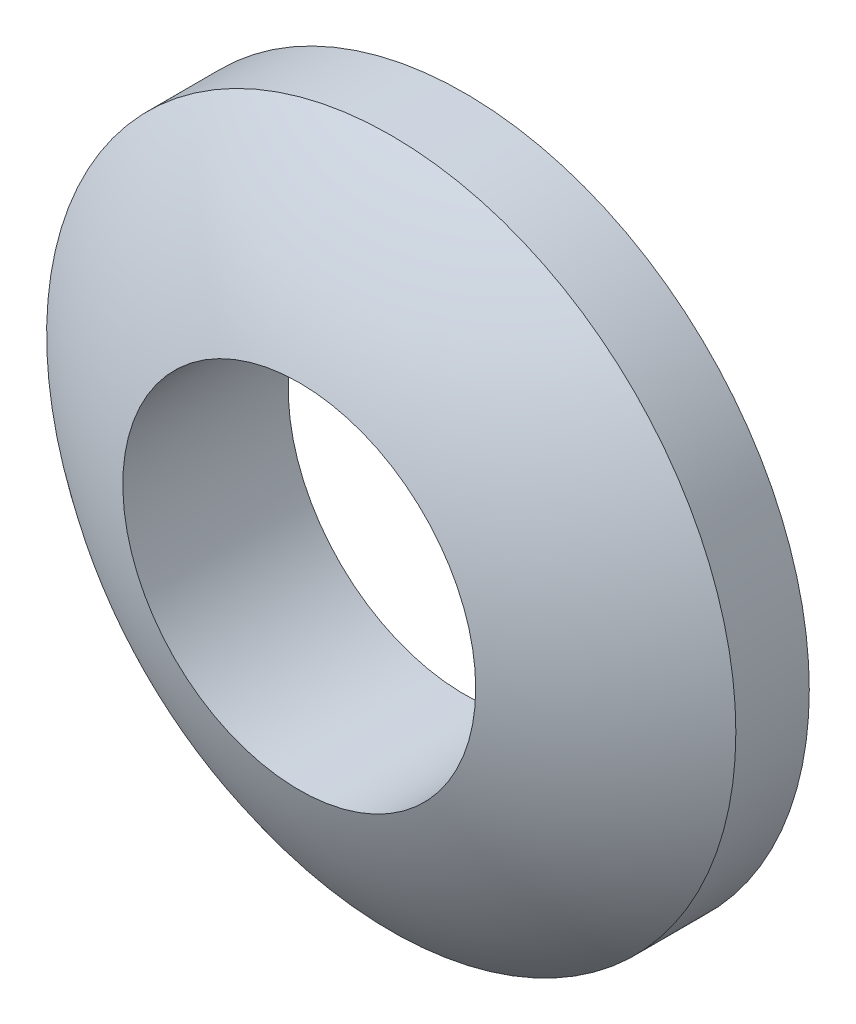
from build123d import *


with BuildPart() as part:
    # Sketch1 → Base-Revolve (revolve)
    with BuildSketch(Plane(origin=(0, 0, 0), x_dir=(0, -1, 0), z_dir=(-1, 0, 0))):
        with BuildLine():
            Line((-3.2, -3), (-6.25, -3))
            Line((-6.25, -3), (-6.25, -1.667927928))
            ThreePointArc((-6.25, -1.667927928), (-4.798033023, -0.700414596), (-3.2, 0))
            Line((-3.2, 0), (-3.2, -3))
        make_face()
    revolve(axis=Axis((0, 0, 58.050097087), (0, 0, -1)))


solid = part.part
